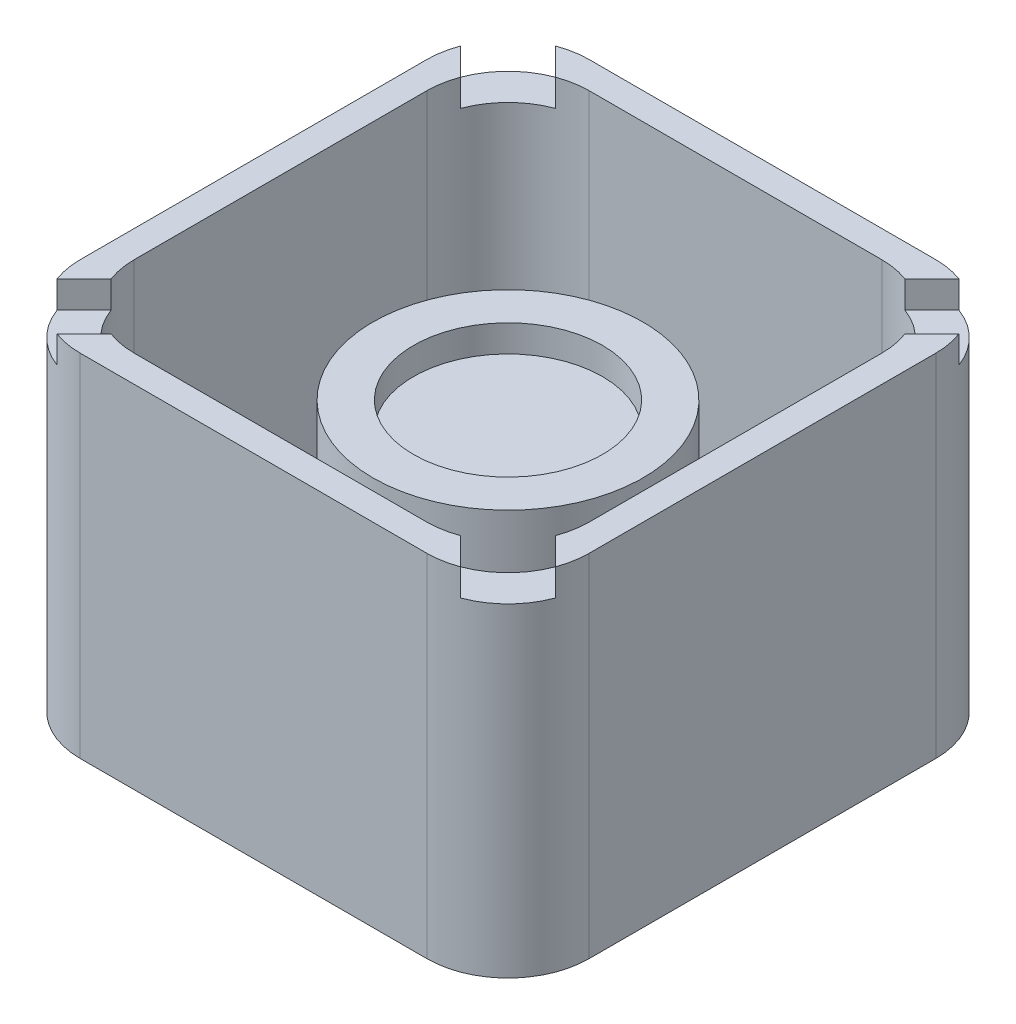
from build123d import *

# Parameters (mm, degrees)
EXTRUDE_3_DEPTH = 10
EXTRUDE_START   = -12
EXTRUDE_4_DEPTH = 2
EXTRUDE_START_2 = 1
EXTRUDE_5_DEPTH = 1
SKETCH_2_R      = 5
SKETCH_2_R_2    = 3.5
EXTRUDE_6_DEPTH = 8
SKETCH_2_2_R    = 3.5
EXTRUDE_7_DEPTH = 7


# Read off the part's stored shape, not the designer's step: 凸台-拉伸4
with BuildPart() as part:
    # 草图1 → 凸台-拉伸3 (new body)
    with BuildSketch(Plane(origin=(0, 0, 0), x_dir=(1, 0, 0), z_dir=(0, 1, 0))):
        with BuildLine():
            Line((-8.229462415, 6.472103102), (-9.229462415, 7.472103102))
            ThreePointArc((-9.229462415, 7.472103102), (-9.371981305, 6.954608621), (-9.42, 6.42))
            Line((-9.42, 6.42), (-9.42, -6.42))
            ThreePointArc((-9.42, -6.42), (-9.371981305, -6.954608621), (-9.229462415, -7.472103102))
            Line((-9.229462415, -7.472103102), (-8.229462415, -6.472103102))
            ThreePointArc((-8.229462415, -6.472103102), (-8.371981305, -5.954608621), (-8.42, -5.42))
            Line((-8.42, -5.42), (-8.42, 5.42))
            ThreePointArc((-8.42, 5.42), (-8.371981305, 5.954608621), (-8.229462415, 6.472103102))
        make_face()
        with BuildLine():
            Line((-6.472103102, 8.229462415), (-7.472103102, 9.229462415))
            ThreePointArc((-7.472103102, 9.229462415), (-8.541320344, 8.541320344), (-9.229462415, 7.472103102))
            Line((-9.229462415, 7.472103102), (-8.229462415, 6.472103102))
            ThreePointArc((-8.229462415, 6.472103102), (-7.541320344, 7.541320344), (-6.472103102, 8.229462415))
        make_face()
        with BuildLine():
            ThreePointArc((7.472103102, 9.229462415), (6.954608621, 9.371981305), (6.42, 9.42))
            Line((6.42, 9.42), (-6.42, 9.42))
            ThreePointArc((-6.42, 9.42), (-6.954608621, 9.371981305), (-7.472103102, 9.229462415))
            Line((-7.472103102, 9.229462415), (-6.472103102, 8.229462415))
            ThreePointArc((-6.472103102, 8.229462415), (-5.954608621, 8.371981305), (-5.42, 8.42))
            Line((-5.42, 8.42), (5.42, 8.42))
            ThreePointArc((5.42, 8.42), (5.954608621, 8.371981305), (6.472103102, 8.229462415))
            Line((6.472103102, 8.229462415), (7.472103102, 9.229462415))
        make_face()
        with BuildLine():
            Line((-8.229462415, -6.472103102), (-9.229462415, -7.472103102))
            ThreePointArc((-9.229462415, -7.472103102), (-8.541320344, -8.541320344), (-7.472103102, -9.229462415))
            Line((-7.472103102, -9.229462415), (-6.472103102, -8.229462415))
            ThreePointArc((-6.472103102, -8.229462415), (-7.541320344, -7.541320344), (-8.229462415, -6.472103102))
        make_face()
        with BuildLine():
            ThreePointArc((6.42, -9.42), (6.954608621, -9.371981305), (7.472103102, -9.229462415))
            Line((7.472103102, -9.229462415), (6.472103102, -8.229462415))
            ThreePointArc((6.472103102, -8.229462415), (5.954608621, -8.371981305), (5.42, -8.42))
            Line((5.42, -8.42), (-5.42, -8.42))
            ThreePointArc((-5.42, -8.42), (-5.954608621, -8.371981305), (-6.472103102, -8.229462415))
            Line((-6.472103102, -8.229462415), (-7.472103102, -9.229462415))
            ThreePointArc((-7.472103102, -9.229462415), (-6.954608621, -9.371981305), (-6.42, -9.42))
            Line((-6.42, -9.42), (6.42, -9.42))
        make_face()
        with BuildLine():
            ThreePointArc((7.472103102, -9.229462415), (8.541320344, -8.541320344), (9.229462415, -7.472103102))
            Line((9.229462415, -7.472103102), (8.229462415, -6.472103102))
            ThreePointArc((8.229462415, -6.472103102), (7.541320344, -7.541320344), (6.472103102, -8.229462415))
            Line((6.472103102, -8.229462415), (7.472103102, -9.229462415))
        make_face()
        with BuildLine():
            ThreePointArc((9.42, 6.42), (9.371981305, 6.954608621), (9.229462415, 7.472103102))
            Line((9.229462415, 7.472103102), (8.229462415, 6.472103102))
            ThreePointArc((8.229462415, 6.472103102), (8.371981305, 5.954608621), (8.42, 5.42))
            Line((8.42, 5.42), (8.42, -5.42))
            ThreePointArc((8.42, -5.42), (8.371981305, -5.954608621), (8.229462415, -6.472103102))
            Line((8.229462415, -6.472103102), (9.229462415, -7.472103102))
            ThreePointArc((9.229462415, -7.472103102), (9.371981305, -6.954608621), (9.42, -6.42))
            Line((9.42, -6.42), (9.42, 6.42))
        make_face()
        with BuildLine():
            ThreePointArc((9.229462415, 7.472103102), (8.541320344, 8.541320344), (7.472103102, 9.229462415))
            Line((7.472103102, 9.229462415), (6.472103102, 8.229462415))
            ThreePointArc((6.472103102, 8.229462415), (7.541320344, 7.541320344), (8.229462415, 6.472103102))
            Line((8.229462415, 6.472103102), (9.229462415, 7.472103102))
        make_face()
    extrude(amount=-EXTRUDE_3_DEPTH)

    # 凸台-拉伸4 outline → 凸台-拉伸4 (add)
    with BuildSketch(Plane(origin=(0, 0, 0), x_dir=(1, 0, 0), z_dir=(0, 1, 0)).offset(EXTRUDE_START)):
        with BuildLine():
            Line((-9.42, 6.42), (-9.42, -6.42))
            ThreePointArc((-9.42, -6.42), (-8.541320344, -8.541320344), (-6.42, -9.42))
            Line((-6.42, -9.42), (6.42, -9.42))
            ThreePointArc((6.42, -9.42), (8.541320344, -8.541320344), (9.42, -6.42))
            Line((9.42, -6.42), (9.42, 6.42))
            ThreePointArc((9.42, 6.42), (8.541320344, 8.541320344), (6.42, 9.42))
            Line((6.42, 9.42), (-6.42, 9.42))
            ThreePointArc((-6.42, 9.42), (-8.541320344, 8.541320344), (-9.42, 6.42))
        make_face()
    extrude(amount=EXTRUDE_4_DEPTH)

    # 草图1<7> → 凸台-拉伸5 (add)
    with BuildSketch(Plane(origin=(0, 0, 0), x_dir=(1, 0, 0), z_dir=(0, 1, 0)).offset(EXTRUDE_START_2)):
        with BuildLine():
            Line((-8.229462415, 6.472103102), (-9.229462415, 7.472103102))
            ThreePointArc((-9.229462415, 7.472103102), (-9.371981305, 6.954608621), (-9.42, 6.42))
            Line((-9.42, 6.42), (-9.42, -6.42))
            ThreePointArc((-9.42, -6.42), (-9.371981305, -6.954608621), (-9.229462415, -7.472103102))
            Line((-9.229462415, -7.472103102), (-8.229462415, -6.472103102))
            ThreePointArc((-8.229462415, -6.472103102), (-8.371981305, -5.954608621), (-8.42, -5.42))
            Line((-8.42, -5.42), (-8.42, 5.42))
            ThreePointArc((-8.42, 5.42), (-8.371981305, 5.954608621), (-8.229462415, 6.472103102))
        make_face()
        with BuildLine():
            ThreePointArc((7.472103102, 9.229462415), (6.954608621, 9.371981305), (6.42, 9.42))
            Line((6.42, 9.42), (-6.42, 9.42))
            ThreePointArc((-6.42, 9.42), (-6.954608621, 9.371981305), (-7.472103102, 9.229462415))
            Line((-7.472103102, 9.229462415), (-6.472103102, 8.229462415))
            ThreePointArc((-6.472103102, 8.229462415), (-5.954608621, 8.371981305), (-5.42, 8.42))
            Line((-5.42, 8.42), (5.42, 8.42))
            ThreePointArc((5.42, 8.42), (5.954608621, 8.371981305), (6.472103102, 8.229462415))
            Line((6.472103102, 8.229462415), (7.472103102, 9.229462415))
        make_face()
        with BuildLine():
            ThreePointArc((9.42, 6.42), (9.371981305, 6.954608621), (9.229462415, 7.472103102))
            Line((9.229462415, 7.472103102), (8.229462415, 6.472103102))
            ThreePointArc((8.229462415, 6.472103102), (8.371981305, 5.954608621), (8.42, 5.42))
            Line((8.42, 5.42), (8.42, -5.42))
            ThreePointArc((8.42, -5.42), (8.371981305, -5.954608621), (8.229462415, -6.472103102))
            Line((8.229462415, -6.472103102), (9.229462415, -7.472103102))
            ThreePointArc((9.229462415, -7.472103102), (9.371981305, -6.954608621), (9.42, -6.42))
            Line((9.42, -6.42), (9.42, 6.42))
        make_face()
        with BuildLine():
            ThreePointArc((6.42, -9.42), (6.954608621, -9.371981305), (7.472103102, -9.229462415))
            Line((7.472103102, -9.229462415), (6.472103102, -8.229462415))
            ThreePointArc((6.472103102, -8.229462415), (5.954608621, -8.371981305), (5.42, -8.42))
            Line((5.42, -8.42), (-5.42, -8.42))
            ThreePointArc((-5.42, -8.42), (-5.954608621, -8.371981305), (-6.472103102, -8.229462415))
            Line((-6.472103102, -8.229462415), (-7.472103102, -9.229462415))
            ThreePointArc((-7.472103102, -9.229462415), (-6.954608621, -9.371981305), (-6.42, -9.42))
            Line((-6.42, -9.42), (6.42, -9.42))
        make_face()
    extrude(amount=-EXTRUDE_5_DEPTH)

    # 草图2 → 凸台-拉伸6 (add)
    with BuildSketch(Plane(origin=(0, -10, 0), x_dir=(1, 0, 0), z_dir=(0, 1, 0))):
        with Locations(Location((0, 0, 0), (0, 0, 270))):
            Circle(SKETCH_2_R)
        with Locations(Location((0, 0, 0), (0, 0, 270))):
            Circle(SKETCH_2_R_2, mode=Mode.SUBTRACT)
    extrude(amount=EXTRUDE_6_DEPTH)

    # 草图2<2> → 凸台-拉伸7 (add)
    with BuildSketch(Plane(origin=(0, -10, 0), x_dir=(1, 0, 0), z_dir=(0, 1, 0))):
        with Locations(Location((0, 0, 0), (0, 0, 270))):
            Circle(SKETCH_2_2_R)
    extrude(amount=EXTRUDE_7_DEPTH)


solid = part.part
